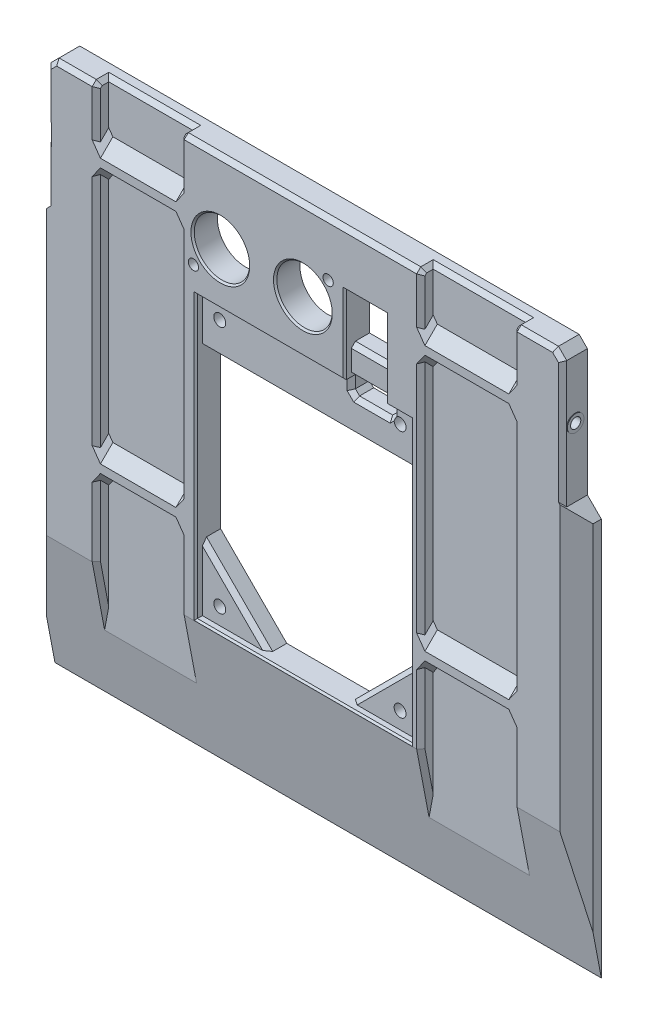
from build123d import *

# Parameters (mm, degrees)
SKETCH1_W               = 165.1
SKETCH1_H               = 165.1
BOSS_EXTRUDE1_DEPTH     = 7.5
SKETCH2_W               = 65
SKETCH2_H               = 85
SKETCH2_W_2             = 12.5
SKETCH2_H_2             = 8.722707295
CUT_EXTRUDE1_DEPTH      = 2
SKETCH3_R               = 1.8
CUT_EXTRUDE2_DEPTH      = 117.872815488
CUT_EXTRUDE5_DEPTH      = 117.872815488
CUT_EXTRUDE5_DEPTH_BACK = 117.872815488
SKETCH4_W               = 12.5
SKETCH4_H               = 15
SKETCH4_H_2             = 5
SKETCH5_R               = 1.55
SKETCH5_R_2             = 8.375
CUT_EXTRUDE6_DEPTH      = 117.983994632
CHAMFER1_SIZE           = 0.5
CHAMFER2_SIZE           = 1.25
CHAMFER3_SIZE           = 7.5
CHAMFER3_SIZE_2         = 39.5
SKETCH12_W              = 5
SKETCH12_H              = 40
SKETCH12_W_2            = 4.2
CUT_EXTRUDE11_DEPTH     = 117.983994632
SKETCH13_R              = 0.7
CUT_EXTRUDE12_DEPTH     = 10
SKETCH14_RX             = 11.205970324
SKETCH14_RY             = 3.425841458
CUT_EXTRUDE13_DEPTH     = 1.5
SKETCH15_R              = 1.55
CUT_EXTRUDE14_DEPTH     = 10
BOSS_EXTRUDE2_START     = 0.2
SKETCH16_R              = 2.5
SKETCH16_R_2            = 1.55
BOSS_EXTRUDE2_DEPTH     = 0.2
CHAMFER5_SIZE           = 5
CHAMFER6_SIZE           = 2.5
CHAMFER7_SIZE           = 1.25
CHAMFER8_SIZE           = 5
CHAMFER9_SIZE           = 1.25
CHAMFER10_SIZE          = 1.25
CHAMFER11_SIZE          = 1.25
SKETCH17_W              = 27.85
SKETCH17_H              = 3.75
SKETCH17_W_2            = 25.3
CUT_EXTRUDE15_DEPTH     = 185.739715684
SKETCH18_W              = 25.3
SKETCH18_H              = 10
SKETCH18_W_2            = 27.85
BOSS_EXTRUDE3_DEPTH     = 3.75
CHAMFER12_SIZE          = 3.75
CHAMFER14_SIZE          = 1.25
CHAMFER15_SIZE          = 1.25


# Some blends are built 0.0001 mm under size
with BuildPart() as part:
    # Sketch1 → Boss-Extrude1 (new body)
    with BuildSketch(Plane.XY):
        Rectangle(SKETCH1_W, SKETCH1_H)
    extrude(amount=BOSS_EXTRUDE1_DEPTH)

    # Sketch2 → Cut-Extrude1 (cut)
    with BuildSketch(Plane.XY.offset(7.5)):
        Rectangle(SKETCH2_W, SKETCH2_H)
        with Locations((18.75, 46.861353648)):
            Rectangle(SKETCH2_W_2, SKETCH2_H_2)
    extrude(amount=-CUT_EXTRUDE1_DEPTH, mode=Mode.SUBTRACT)

    # Sketch3 → Cut-Extrude2 (cut, through all)
    with BuildSketch(Plane.XY.offset(5.5)):
        with Locations((-27.25, 37.5)):
            Circle(SKETCH3_R)
        with Locations((27.25, 37.5)):
            Circle(SKETCH3_R)
        with Locations((-27.25, -37.5)):
            Circle(SKETCH3_R)
        with Locations((27.25, -37.5)):
            Circle(SKETCH3_R)
    extrude(amount=-CUT_EXTRUDE2_DEPTH, mode=Mode.SUBTRACT)

    # Sketch4 → Cut-Extrude5 (cut, two sides: drawn at the far end of the back side and taken through both)
    with BuildSketch(Plane.XY.offset(5.5).offset(-CUT_EXTRUDE5_DEPTH_BACK)):
        Polygon((-32.5, 27.5), (32.5, 27.5), (32.5, -22.5), (12.5, -42.5), (-12.5, -42.5), (-32.5, -22.5), align=None)
        with Locations((18.75, 58.722707295)):
            Rectangle(SKETCH4_W, SKETCH4_H)
        with Locations((18.75, 40)):
            Rectangle(SKETCH4_W, SKETCH4_H_2)
    extrude(amount=CUT_EXTRUDE5_DEPTH + CUT_EXTRUDE5_DEPTH_BACK, mode=Mode.SUBTRACT)

    # Sketch5 → Cut-Extrude6 (cut, through all)
    with BuildSketch(Plane(origin=(0, 0, 0), x_dir=(-1, 0, 0), z_dir=(0, 0, -1))):
        with Locations((-7.5, 66.3)):
            Circle(SKETCH5_R)
        with Locations((33.2, 50)):
            Circle(SKETCH5_R)
        with Locations((0.129678703, 58.15)):
            Circle(SKETCH5_R_2)
        with Locations(Location((25.079678703, 58.15, 0), (0, 0, 180))):
            Circle(SKETCH5_R_2)
    extrude(amount=-CUT_EXTRUDE6_DEPTH, mode=Mode.SUBTRACT)

    # Chamfer1
    chamfer1_edges = [part.edges().sort_by_distance(p)[0] for p in [
        (8.245321297, 58.15, 7.5),
        (-33.454678703, 58.15, 7.5),
        (32.5, 0, 7.5),
        (-10, 42.5, 7.5),
        (12.5, 54.361353648, 7.5),
        (28.75, 42.5, 7.5),
        (25, 54.361353648, 7.5),
        (-32.5, 0, 7.5),
        (0, -42.5, 7.5),
        (18.75, 66.222707295, 7.5),
    ]]
    chamfer(chamfer1_edges, length=CHAMFER1_SIZE)

    # Chamfer2
    chamfer2_edges = [part.edges().sort_by_distance(p)[0] for p in [
        (12.5, 37.5, 2.75),
        (25, 37.5, 2.75),
    ]]
    chamfer(chamfer2_edges, length=CHAMFER2_SIZE)

    # Chamfer3
    # the kernel refuses this chamfer: 39.5, 7.5 mm, written as the material it takes off along each edge
    with BuildSketch(Plane(origin=(-185.183311652, -82.55, 7.5), x_dir=(0, -0.1953078881118558, -0.9807419787290064), z_dir=(1, 0, 0))) as chamfer3_piece_1:
        Polygon((CHAMFER3_SIZE * 0.980741978729, CHAMFER3_SIZE * 0.195307888112), (-CHAMFER3_SIZE_2 * 0.195307888112, CHAMFER3_SIZE_2 * 0.980741978729), (0, 0), align=None)
    extrude(amount=370.366623303, mode=Mode.SUBTRACT)

    # Sketch12 → Cut-Extrude11 (cut, through all)
    with BuildSketch(Plane.XY.offset(7.5)):
        with Locations((-80.05, 62.55)):
            Rectangle(SKETCH12_W, SKETCH12_H)
        with Locations((80.45, 62.55)):
            Rectangle(SKETCH12_W_2, SKETCH12_H)
    extrude(amount=-CUT_EXTRUDE11_DEPTH, mode=Mode.SUBTRACT)

    # Sketch13 → Cut-Extrude12 (cut)
    with BuildSketch(Plane.ZY.offset(77.55)):
        with Locations(Location((3.75, 67.55, 0), (0, 0, 270))):
            Circle(SKETCH13_R)
        with Locations(Location((3.75, 70.55, 0), (0, 0, 270))):
            Circle(SKETCH13_R)
        with Locations(Location((3.75, 73.55, 0), (0, 0, 270))):
            Circle(SKETCH13_R)
        with Locations(Location((3.75, 76.55, 0), (0, 0, 270))):
            Circle(SKETCH13_R)
        with Locations(Location((3.75, 48.55, 0), (0, 0, 90))):
            Circle(SKETCH13_R)
        with Locations(Location((3.75, 51.55, 0), (0, 0, 90))):
            Circle(SKETCH13_R)
        with Locations(Location((3.75, 54.55, 0), (0, 0, 90))):
            Circle(SKETCH13_R)
        with Locations(Location((3.75, 57.55, 0), (0, 0, 90))):
            Circle(SKETCH13_R)
    extrude(amount=-CUT_EXTRUDE12_DEPTH, mode=Mode.SUBTRACT)

    # Sketch14 → Cut-Extrude13 (cut)
    with BuildSketch(Plane.ZY.offset(77.55)):
        with Locations(Location((3.75, 62.55), (0, 0, 180))):
            Ellipse(SKETCH14_RX, SKETCH14_RY)
    extrude(amount=-CUT_EXTRUDE13_DEPTH, mode=Mode.SUBTRACT)

    # Sketch15 → Cut-Extrude14 (cut)
    with BuildSketch(Plane(origin=(78.35, 0, 0), x_dir=(0, 0, -1), z_dir=(1, 0, 0))):
        with Locations((-3.75, 62.55)):
            Circle(SKETCH15_R)
    extrude(amount=-CUT_EXTRUDE14_DEPTH, mode=Mode.SUBTRACT)

    # Sketch16 → Boss-Extrude2 (add)
    with BuildSketch(Plane(origin=(78.35, 0, 0), x_dir=(0, 0, -1), z_dir=(1, 0, 0)).offset(BOSS_EXTRUDE2_START)):
        with Locations(Location((-3.75, 62.55, 0), (0, 0, 180))):
            Circle(SKETCH16_R)
        with Locations((-3.75, 62.55)):
            Circle(SKETCH16_R_2, mode=Mode.SUBTRACT)
    extrude(amount=-BOSS_EXTRUDE2_DEPTH)

    # Chamfer5
    # the kernel refuses this chamfer: 5 mm, written as the material it takes off along each edge
    with BuildSketch(Plane(origin=(82.55, 42.55, 20.35841494), x_dir=(0.02749587661059046, -0.9996219169112965, 0), z_dir=(0, 0, -1))) as chamfer5_piece_1_section:
        Polygon((CHAMFER5_SIZE * 0.999621916911, CHAMFER5_SIZE * 0.0274958766106), (-CHAMFER5_SIZE * 0.0274958766106, CHAMFER5_SIZE * 0.999621916911), (0, 0), align=None)
    chamfer5_piece_1 = extrude(amount=33.21682988, mode=Mode.PRIVATE)
    chamfer5_piece_1 = split(chamfer5_piece_1, bisect_by=Plane(origin=(78.35, 40.843319127, 3.75), z_dir=(1, 0, 0)), keep=Keep.TOP, mode=Mode.PRIVATE)
    add(chamfer5_piece_1, mode=Mode.SUBTRACT)
    with BuildSketch(Plane(origin=(-82.55, 42.55, 20.35841494), x_dir=(0.9996219169112968, 0.027495876610586282, 0), z_dir=(0, 0, -1))) as chamfer5_piece_2_section:
        Polygon((CHAMFER5_SIZE * 0.999621916911, CHAMFER5_SIZE * 0.0274958766106), (-CHAMFER5_SIZE * 0.0274958766106, CHAMFER5_SIZE * 0.999621916911), (0, 0), align=None)
    chamfer5_piece_2 = extrude(amount=33.21682988, mode=Mode.PRIVATE)
    chamfer5_piece_2 = split(chamfer5_piece_2, bisect_by=Plane(origin=(-77.55, 40.897979228, 3.75), z_dir=(-1, 0, 0)), keep=Keep.TOP, mode=Mode.PRIVATE)
    add(chamfer5_piece_2, mode=Mode.SUBTRACT)

    # Chamfer6
    chamfer6_edges = [part.edges().sort_by_distance(p)[0] for p in [
        (-77.55, 82.55, 3.75),
        (78.35, 82.55, 3.75),
    ]]
    chamfer(chamfer6_edges, length=CHAMFER6_SIZE)

    # Chamfer7
    chamfer7_edges = [part.edges().sort_by_distance(p)[0] for p in [
        (-77.55, 50.935837774, 7.5),
        (-77.55, 72.914162226, 7.5),
        (78.35, 60.9, 7.5),
        (0.4, 82.55, 7.5),
        (-76.3, 81.3, 7.5),
        (77.1, 81.3, 7.5),
    ]]
    chamfer(chamfer7_edges, length=CHAMFER7_SIZE - 0.0001)  # a hair under: the kernel refuses the full size

    # Chamfer8
    chamfer8_edges = [part.edges().sort_by_distance(p)[0] for p in [
        (82.55, -2.75, 7.5),
        (-82.55, -2.75, 7.5),
    ]]
    chamfer(chamfer8_edges, length=CHAMFER8_SIZE)

    # Chamfer9
    # the kernel refuses this chamfer: 1.25 mm, written as the material it takes off along each edge
    with BuildSketch(Plane(origin=(26.964603735, 37.5, 5.5), x_dir=(0, 0.0274958766105877, -0.9996219169112968), z_dir=(-1, 0, 0))) as chamfer9_piece_1_section:
        Polygon((CHAMFER9_SIZE * 0.999621916911, CHAMFER9_SIZE * 0.0274958766106), (-CHAMFER9_SIZE * 0.0274958766106, CHAMFER9_SIZE * 0.999621916911), (0, 0), align=None)
    chamfer9_piece_1 = extrude(amount=16.42920747, mode=Mode.PRIVATE)
    chamfer9_piece_1 = split(chamfer9_piece_1, bisect_by=Plane(origin=(21.054692841, 34.804692841, 5.076195697), z_dir=(-0.7071067811865476, 0.7071067811865476, 0)), keep=Keep.TOP, mode=Mode.PRIVATE)
    chamfer9_piece_1 = split(chamfer9_piece_1, bisect_by=Plane(origin=(16.445307159, 34.804692841, 5.076195697), z_dir=(0.7071067811865476, 0.7071067811865476, 0)), keep=Keep.TOP, mode=Mode.PRIVATE)
    add(chamfer9_piece_1, mode=Mode.SUBTRACT)
    with BuildSketch(Plane(origin=(25, 42.5, 5.5), x_dir=(-0.0274958766105877, 0, -0.9996219169112968), z_dir=(0, -1, 0))) as chamfer9_piece_2_section:
        Polygon((CHAMFER9_SIZE * 0.999621916911, CHAMFER9_SIZE * 0.0274958766106), (-CHAMFER9_SIZE * 0.0274958766106, CHAMFER9_SIZE * 0.999621916911), (0, 0), align=None)
    chamfer9_piece_2 = extrude(amount=6.964603735, mode=Mode.PRIVATE)
    chamfer9_piece_2 = split(chamfer9_piece_2, bisect_by=Plane(origin=(26.224386007, 39.974386007, 5.071865593), z_dir=(-0.7071067811865476, 0.7071067811865476, 0)), keep=Keep.TOP, mode=Mode.PRIVATE)
    add(chamfer9_piece_2, mode=Mode.SUBTRACT)
    with BuildSketch(Plane(origin=(10.2269319, 41.0230681, 5.5), x_dir=(0.019442520806013795, 0.019442520806013795, -0.9996219169112968), z_dir=(0.7071067811865476, -0.7071067811865476, 0))) as chamfer9_piece_3_section:
        Polygon((CHAMFER9_SIZE * 0.999621916911, -CHAMFER9_SIZE * 0.0274958766106), (-CHAMFER9_SIZE * 0.0274958766106, -CHAMFER9_SIZE * 0.999621916911), (0, 0), align=None)
    chamfer9_piece_3 = extrude(amount=8.196974423, mode=Mode.PRIVATE)
    chamfer9_piece_3 = split(chamfer9_piece_3, bisect_by=Plane(origin=(12.350335943, 37.5, 5.446070934), z_dir=(0, -1, 0)), keep=Keep.TOP, mode=Mode.PRIVATE)
    chamfer9_piece_3 = split(chamfer9_piece_3, bisect_by=Plane(origin=(12.5, 37.350335943, 5.446070934), z_dir=(-1, 0, 0)), keep=Keep.TOP, mode=Mode.PRIVATE)
    add(chamfer9_piece_3, mode=Mode.SUBTRACT)
    with BuildSketch(Plane(origin=(10.2269319, 41.0230681, 5.5), x_dir=(0.019442520806013795, 0.019442520806013795, -0.9996219169112968), z_dir=(0.7071067811865476, -0.7071067811865476, 0))) as chamfer9_piece_4_section:
        Polygon((CHAMFER9_SIZE * 0.999621916911, -CHAMFER9_SIZE * 0.0274958766106), (-CHAMFER9_SIZE * 0.0274958766106, -CHAMFER9_SIZE * 0.999621916911), (0, 0), align=None)
    chamfer9_piece_4 = extrude(amount=8.196974423, mode=Mode.PRIVATE)
    chamfer9_piece_4 = split(chamfer9_piece_4, bisect_by=Plane(origin=(12.964093962, 37.5, 4.988823058), z_dir=(0, 1, 0)), keep=Keep.TOP, mode=Mode.PRIVATE)
    chamfer9_piece_4 = split(chamfer9_piece_4, bisect_by=Plane(origin=(12.5, 37.964093962, 4.988823058), z_dir=(1, 0, 0)), keep=Keep.TOP, mode=Mode.PRIVATE)
    add(chamfer9_piece_4, mode=Mode.SUBTRACT)
    with BuildSketch(Plane(origin=(27.2730681, 41.0230681, 5.5), x_dir=(-0.0194425208060131, 0.0194425208060131, -0.9996219169112968), z_dir=(-0.7071067811865476, -0.7071067811865476, 0))) as chamfer9_piece_5_section:
        Polygon((CHAMFER9_SIZE * 0.999621916911, CHAMFER9_SIZE * 0.0274958766106), (-CHAMFER9_SIZE * 0.0274958766106, CHAMFER9_SIZE * 0.999621916911), (0, 0), align=None)
    chamfer9_piece_5 = extrude(amount=8.196974423, mode=Mode.PRIVATE)
    chamfer9_piece_5 = split(chamfer9_piece_5, bisect_by=Plane(origin=(25, 37.350335943, 5.446070934), z_dir=(1, 0, 0)), keep=Keep.TOP, mode=Mode.PRIVATE)
    chamfer9_piece_5 = split(chamfer9_piece_5, bisect_by=Plane(origin=(25.149664057, 37.5, 5.446070934), z_dir=(0, -1, 0)), keep=Keep.TOP, mode=Mode.PRIVATE)
    add(chamfer9_piece_5, mode=Mode.SUBTRACT)
    with BuildSketch(Plane(origin=(27.2730681, 41.0230681, 5.5), x_dir=(-0.0194425208060131, 0.0194425208060131, -0.9996219169112968), z_dir=(-0.7071067811865476, -0.7071067811865476, 0))) as chamfer9_piece_6_section:
        Polygon((CHAMFER9_SIZE * 0.999621916911, CHAMFER9_SIZE * 0.0274958766106), (-CHAMFER9_SIZE * 0.0274958766106, CHAMFER9_SIZE * 0.999621916911), (0, 0), align=None)
    chamfer9_piece_6 = extrude(amount=8.196974423, mode=Mode.PRIVATE)
    chamfer9_piece_6 = split(chamfer9_piece_6, bisect_by=Plane(origin=(25, 37.964093962, 4.988823058), z_dir=(-1, 0, 0)), keep=Keep.TOP, mode=Mode.PRIVATE)
    chamfer9_piece_6 = split(chamfer9_piece_6, bisect_by=Plane(origin=(24.535906038, 37.5, 4.988823058), z_dir=(0, 1, 0)), keep=Keep.TOP, mode=Mode.PRIVATE)
    add(chamfer9_piece_6, mode=Mode.SUBTRACT)
    with BuildSketch(Plane(origin=(12.5, 35.535396265, 5.5), x_dir=(0.027495876610586317, 0, -0.9996219169112968), z_dir=(0, 1, 0))) as chamfer9_piece_7_section:
        Polygon((CHAMFER9_SIZE * 0.999621916911, CHAMFER9_SIZE * 0.0274958766106), (-CHAMFER9_SIZE * 0.0274958766106, CHAMFER9_SIZE * 0.999621916911), (0, 0), align=None)
    chamfer9_piece_7 = extrude(amount=6.964603735, mode=Mode.PRIVATE)
    chamfer9_piece_7 = split(chamfer9_piece_7, bisect_by=Plane(origin=(11.275613993, 39.974386007, 5.071865593), z_dir=(0.7071067811865476, 0.7071067811865476, 0)), keep=Keep.TOP, mode=Mode.PRIVATE)
    add(chamfer9_piece_7, mode=Mode.SUBTRACT)
    with BuildSketch(Plane(origin=(27.2730681, 41.0230681, 5.5), x_dir=(-0.0194425208060131, 0.0194425208060131, -0.9996219169112968), z_dir=(-0.7071067811865476, -0.7071067811865476, 0))) as chamfer9_piece_8a_section:
        Polygon((CHAMFER9_SIZE * 0.999621916911, CHAMFER9_SIZE * 0.0274958766106), (-CHAMFER9_SIZE * 0.0274958766106, CHAMFER9_SIZE * 0.999621916911), (0, 0), align=None)
    chamfer9_piece_8a = extrude(amount=8.196974423, mode=Mode.PRIVATE)
    chamfer9_piece_8a = split(chamfer9_piece_8a, bisect_by=Plane(origin=(25, 36.199182289, 5.099717349), z_dir=(-1, 0, 0)), keep=Keep.TOP, mode=Mode.PRIVATE)
    chamfer9_piece_8a = split(chamfer9_piece_8a, bisect_by=Plane(origin=(23.063674005, 37.5, 5.099717349), z_dir=(0, -1, 0)), keep=Keep.TOP, mode=Mode.PRIVATE)
    with BuildSketch(Plane(origin=(26.964603735, 37.5, 5.5), x_dir=(0, 0.0274958766105877, -0.9996219169112968), z_dir=(-1, 0, 0))) as chamfer9_piece_8b_section:
        Polygon((CHAMFER9_SIZE * 0.999621916911, CHAMFER9_SIZE * 0.0274958766106), (-CHAMFER9_SIZE * 0.0274958766106, CHAMFER9_SIZE * 0.999621916911), (0, 0), align=None)
    chamfer9_piece_8b = extrude(amount=16.42920747, mode=Mode.PRIVATE)
    chamfer9_piece_8b = split(chamfer9_piece_8b, bisect_by=Plane(origin=(24.223951017, 37.973951017, 5.102383594), z_dir=(0.7071067811865476, -0.7071067811865476, 0)), keep=Keep.TOP, mode=Mode.PRIVATE)
    chamfer9_piece_8 = chamfer9_piece_8a & chamfer9_piece_8b
    add(chamfer9_piece_8, mode=Mode.SUBTRACT)
    with BuildSketch(Plane(origin=(26.964603735, 37.5, 5.5), x_dir=(0, 0.0274958766105877, -0.9996219169112968), z_dir=(-1, 0, 0))) as chamfer9_piece_9a_section:
        Polygon((CHAMFER9_SIZE * 0.999621916911, CHAMFER9_SIZE * 0.0274958766106), (-CHAMFER9_SIZE * 0.0274958766106, CHAMFER9_SIZE * 0.999621916911), (0, 0), align=None)
    chamfer9_piece_9a = extrude(amount=16.42920747, mode=Mode.PRIVATE)
    chamfer9_piece_9a = split(chamfer9_piece_9a, bisect_by=Plane(origin=(13.276048983, 37.973951017, 5.102383594), z_dir=(-0.7071067811865476, -0.7071067811865476, 0)), keep=Keep.TOP, mode=Mode.PRIVATE)
    with BuildSketch(Plane(origin=(10.2269319, 41.0230681, 5.5), x_dir=(0.019442520806013795, 0.019442520806013795, -0.9996219169112968), z_dir=(0.7071067811865476, -0.7071067811865476, 0))) as chamfer9_piece_9b_section:
        Polygon((CHAMFER9_SIZE * 0.999621916911, -CHAMFER9_SIZE * 0.0274958766106), (-CHAMFER9_SIZE * 0.0274958766106, -CHAMFER9_SIZE * 0.999621916911), (0, 0), align=None)
    chamfer9_piece_9b = extrude(amount=8.196974423, mode=Mode.PRIVATE)
    chamfer9_piece_9b = split(chamfer9_piece_9b, bisect_by=Plane(origin=(14.436325995, 37.5, 5.099717349), z_dir=(0, -1, 0)), keep=Keep.TOP, mode=Mode.PRIVATE)
    chamfer9_piece_9b = split(chamfer9_piece_9b, bisect_by=Plane(origin=(12.5, 36.199182289, 5.099717349), z_dir=(1, 0, 0)), keep=Keep.TOP, mode=Mode.PRIVATE)
    chamfer9_piece_9 = chamfer9_piece_9a & chamfer9_piece_9b
    add(chamfer9_piece_9, mode=Mode.SUBTRACT)
    with BuildSketch(Plane(origin=(25, 42.5, 5.5), x_dir=(-0.0274958766105877, 0, -0.9996219169112968), z_dir=(0, -1, 0))) as chamfer9_piece_10a_section:
        Polygon((CHAMFER9_SIZE * 0.999621916911, CHAMFER9_SIZE * 0.0274958766106), (-CHAMFER9_SIZE * 0.0274958766106, CHAMFER9_SIZE * 0.999621916911), (0, 0), align=None)
    chamfer9_piece_10a = extrude(amount=6.964603735, mode=Mode.PRIVATE)
    chamfer9_piece_10a = split(chamfer9_piece_10a, bisect_by=Plane(origin=(24.526048983, 38.276048983, 5.102383594), z_dir=(0.7071067811865476, -0.7071067811865476, 0)), keep=Keep.TOP, mode=Mode.PRIVATE)
    with BuildSketch(Plane(origin=(27.2730681, 41.0230681, 5.5), x_dir=(-0.0194425208060131, 0.0194425208060131, -0.9996219169112968), z_dir=(-0.7071067811865476, -0.7071067811865476, 0))) as chamfer9_piece_10b_section:
        Polygon((CHAMFER9_SIZE * 0.999621916911, CHAMFER9_SIZE * 0.0274958766106), (-CHAMFER9_SIZE * 0.0274958766106, CHAMFER9_SIZE * 0.999621916911), (0, 0), align=None)
    chamfer9_piece_10b = extrude(amount=8.196974423, mode=Mode.PRIVATE)
    chamfer9_piece_10b = split(chamfer9_piece_10b, bisect_by=Plane(origin=(25, 39.436325995, 5.099717349), z_dir=(1, 0, 0)), keep=Keep.TOP, mode=Mode.PRIVATE)
    chamfer9_piece_10b = split(chamfer9_piece_10b, bisect_by=Plane(origin=(26.300817711, 37.5, 5.099717349), z_dir=(0, 1, 0)), keep=Keep.TOP, mode=Mode.PRIVATE)
    chamfer9_piece_10 = chamfer9_piece_10a & chamfer9_piece_10b
    add(chamfer9_piece_10, mode=Mode.SUBTRACT)
    with BuildSketch(Plane(origin=(12.5, 35.535396265, 5.5), x_dir=(0.027495876610586317, 0, -0.9996219169112968), z_dir=(0, 1, 0))) as chamfer9_piece_11a_section:
        Polygon((CHAMFER9_SIZE * 0.999621916911, CHAMFER9_SIZE * 0.0274958766106), (-CHAMFER9_SIZE * 0.0274958766106, CHAMFER9_SIZE * 0.999621916911), (0, 0), align=None)
    chamfer9_piece_11a = extrude(amount=6.964603735, mode=Mode.PRIVATE)
    chamfer9_piece_11a = split(chamfer9_piece_11a, bisect_by=Plane(origin=(12.973951017, 38.276048983, 5.102383594), z_dir=(-0.7071067811865476, -0.7071067811865476, 0)), keep=Keep.TOP, mode=Mode.PRIVATE)
    with BuildSketch(Plane(origin=(10.2269319, 41.0230681, 5.5), x_dir=(0.019442520806013795, 0.019442520806013795, -0.9996219169112968), z_dir=(0.7071067811865476, -0.7071067811865476, 0))) as chamfer9_piece_11b_section:
        Polygon((CHAMFER9_SIZE * 0.999621916911, -CHAMFER9_SIZE * 0.0274958766106), (-CHAMFER9_SIZE * 0.0274958766106, -CHAMFER9_SIZE * 0.999621916911), (0, 0), align=None)
    chamfer9_piece_11b = extrude(amount=8.196974423, mode=Mode.PRIVATE)
    chamfer9_piece_11b = split(chamfer9_piece_11b, bisect_by=Plane(origin=(11.199182289, 37.5, 5.099717349), z_dir=(0, 1, 0)), keep=Keep.TOP, mode=Mode.PRIVATE)
    chamfer9_piece_11b = split(chamfer9_piece_11b, bisect_by=Plane(origin=(12.5, 39.436325995, 5.099717349), z_dir=(-1, 0, 0)), keep=Keep.TOP, mode=Mode.PRIVATE)
    chamfer9_piece_11 = chamfer9_piece_11a & chamfer9_piece_11b
    add(chamfer9_piece_11, mode=Mode.SUBTRACT)

    # Chamfer10
    chamfer10_edges = [part.edges().sort_by_distance(p)[0] for p in [
        (18.75, 51.222707295, 5.5),
        (18.75, 42.5, 5.5),
    ]]
    chamfer(chamfer10_edges, length=CHAMFER10_SIZE - 0.0001)  # a hair under: the kernel refuses the full size

    # Chamfer11
    chamfer11_edges = [part.edges().sort_by_distance(p)[0] for p in [
        (-22.5, -32.5, 5.5),
        (22.5, -32.5, 5.5),
        (0, 27.5, 5.5),
    ]]
    chamfer(chamfer11_edges, length=CHAMFER11_SIZE)

    # Sketch17 → Cut-Extrude15 (cut, through all)
    with BuildSketch(Plane(origin=(0, 82.55, 0), x_dir=(1, 0, 0), z_dir=(0, 1, 0))):
        with Locations((49.425, -5.625)):
            Rectangle(SKETCH17_W, SKETCH17_H)
        with Locations((-49.9, -5.625)):
            Rectangle(SKETCH17_W_2, SKETCH17_H)
    extrude(amount=-CUT_EXTRUDE15_DEPTH, mode=Mode.SUBTRACT)

    # Sketch18 → Boss-Extrude3 (add)
    with BuildSketch(Plane.XY.offset(3.75)):
        with Locations((-49.9, 62.55)):
            Rectangle(SKETCH18_W, SKETCH18_H)
        with Locations((49.425, 62.55)):
            Rectangle(SKETCH18_W_2, SKETCH18_H)
        with Locations((49.425, -17.45)):
            Rectangle(SKETCH18_W_2, SKETCH18_H)
        with Locations((-49.9, -17.45)):
            Rectangle(SKETCH18_W, SKETCH18_H)
    extrude(amount=BOSS_EXTRUDE3_DEPTH)

    # Chamfer12
    chamfer12_edges = [part.edges().sort_by_distance(p)[0] for p in [
        (-49.9, -12.45, 7.5),
        (-49.9, -22.45, 7.5),
        (49.425, -22.45, 7.5),
        (49.425, -12.45, 7.5),
        (49.425, 57.55, 7.5),
        (49.425, 67.55, 7.5),
        (-49.9, 67.55, 7.5),
        (-49.9, 57.55, 7.5),
    ]]
    chamfer(chamfer12_edges, length=CHAMFER12_SIZE - 0.0001)  # a hair under: the kernel refuses the full size

    # Chamfer13
    # the kernel refuses this chamfer: 1.25 mm, written as the material it adds along each edge
    with BuildSketch(Plane(origin=(-62.55, -18.4729681, 9.7730681), x_dir=(-0.02749587661058782, 0.7068394360706736, 0.7068394360706732), z_dir=(2.560750109497795e-15, 0.7071067811865475, -0.7071067811865477))) as chamfer13_piece_1_section:
        with BuildLine():
            Line((1.285841494, 0), (-0.070683944, 1.283897242))
            Line((-0.070683944, 1.283897242), (-0.095674492, 1.283209845))
            ThreePointArc((-0.095674492, 1.283209845), (-0.042661534, 0.641747287), (-0.024990548, -0.000687397))
            Line((-0.024990548, -0.000687397), (0.000687397, -0.024990548))
            ThreePointArc((0.000687397, -0.024990548), (0.643122081, -0.007319562), (1.286528891, -0.024990548))
            Line((1.286528891, -0.024990548), (1.285841494, 0))
        make_face()
    chamfer13_piece_1 = extrude(amount=11.732366907, mode=Mode.PRIVATE)
    chamfer13_piece_1 = split(chamfer13_piece_1, bisect_by=Plane(origin=(-62.114070206, -14.064782029, 7.5), z_dir=(0, 0, -1)), keep=Keep.TOP, mode=Mode.PRIVATE)
    add(chamfer13_piece_1)
    with BuildSketch(Plane(origin=(-37.25, -18.4729681, 9.7730681), x_dir=(0.027495876610587604, 0.7068394360706736, 0.7068394360706733), z_dir=(0, 0.7071067811865475, -0.7071067811865477))) as chamfer13_piece_2_section:
        with BuildLine():
            Line((1.285841494, 0), (-0.070683944, -1.283897242))
            Line((-0.070683944, -1.283897242), (-0.095674492, -1.283209845))
            ThreePointArc((-0.095674492, -1.283209845), (-0.042661534, -0.641747287), (-0.024990548, 0.000687397))
            Line((-0.024990548, 0.000687397), (0.000687397, 0.024990548))
            ThreePointArc((0.000687397, 0.024990548), (0.643122081, 0.007319562), (1.286528891, 0.024990548))
            Line((1.286528891, 0.024990548), (1.285841494, 0))
        make_face()
    chamfer13_piece_2 = extrude(amount=11.732366907, mode=Mode.PRIVATE)
    chamfer13_piece_2 = split(chamfer13_piece_2, bisect_by=Plane(origin=(-37.685929794, -14.064782029, 7.5), z_dir=(0, 0, -1)), keep=Keep.TOP, mode=Mode.PRIVATE)
    add(chamfer13_piece_2)
    with BuildSketch(Plane(origin=(-62.55, -16.4270319, 9.7730681), x_dir=(0.9996219169112968, 0.019442520806014364, -0.01944252080601041), z_dir=(2.798498816142824e-15, -0.7071067811865476, -0.7071067811865475))) as chamfer13_piece_3_section:
        with BuildLine():
            Line((1.285841494, 0), (-0.070683944, 1.283897242))
            Line((-0.070683944, 1.283897242), (-0.095674492, 1.283209845))
            ThreePointArc((-0.095674492, 1.283209845), (-0.042661534, 0.641747287), (-0.024990548, -0.000687397))
            Line((-0.024990548, -0.000687397), (0.000687397, -0.024990548))
            ThreePointArc((0.000687397, -0.024990548), (0.643122081, -0.007319562), (1.286528891, -0.024990548))
            Line((1.286528891, -0.024990548), (1.285841494, 0))
        make_face()
    chamfer13_piece_3 = extrude(amount=11.732366907, mode=Mode.PRIVATE)
    chamfer13_piece_3 = split(chamfer13_piece_3, bisect_by=Plane(origin=(-62.114070206, -20.835217971, 7.5), z_dir=(0, 0, -1)), keep=Keep.TOP, mode=Mode.PRIVATE)
    add(chamfer13_piece_3)
    with BuildSketch(Plane(origin=(-37.25, -16.4270319, 9.7730681), x_dir=(0.02749587661058782, -0.7068394360706733, 0.7068394360706735), z_dir=(0, -0.7071067811865476, -0.7071067811865475))) as chamfer13_piece_4_section:
        with BuildLine():
            Line((1.285841494, 0), (-0.070683944, 1.283897242))
            Line((-0.070683944, 1.283897242), (-0.095674492, 1.283209845))
            ThreePointArc((-0.095674492, 1.283209845), (-0.042661534, 0.641747287), (-0.024990548, -0.000687397))
            Line((-0.024990548, -0.000687397), (0.000687397, -0.024990548))
            ThreePointArc((0.000687397, -0.024990548), (0.643122081, -0.007319562), (1.286528891, -0.024990548))
            Line((1.286528891, -0.024990548), (1.285841494, 0))
        make_face()
    chamfer13_piece_4 = extrude(amount=11.732366907, mode=Mode.PRIVATE)
    chamfer13_piece_4 = split(chamfer13_piece_4, bisect_by=Plane(origin=(-37.685929794, -20.835217971, 7.5), z_dir=(0, 0, -1)), keep=Keep.TOP, mode=Mode.PRIVATE)
    add(chamfer13_piece_4)
    with BuildSketch(Plane(origin=(63.35, -16.4270319, 9.7730681), x_dir=(0.02749587661058782, -0.7068394360706733, 0.7068394360706735), z_dir=(0, -0.7071067811865476, -0.7071067811865475))) as chamfer13_piece_5_section:
        with BuildLine():
            Line((1.285841494, 0), (-0.070683944, 1.283897242))
            Line((-0.070683944, 1.283897242), (-0.095674492, 1.283209845))
            ThreePointArc((-0.095674492, 1.283209845), (-0.042661534, 0.641747287), (-0.024990548, -0.000687397))
            Line((-0.024990548, -0.000687397), (0.000687397, -0.024990548))
            ThreePointArc((0.000687397, -0.024990548), (0.643122081, -0.007319562), (1.286528891, -0.024990548))
            Line((1.286528891, -0.024990548), (1.285841494, 0))
        make_face()
    chamfer13_piece_5 = extrude(amount=11.732366907, mode=Mode.PRIVATE)
    chamfer13_piece_5 = split(chamfer13_piece_5, bisect_by=Plane(origin=(62.914070206, -20.835217971, 7.5), z_dir=(0, 0, -1)), keep=Keep.TOP, mode=Mode.PRIVATE)
    add(chamfer13_piece_5)
    with BuildSketch(Plane(origin=(35.5, -16.4270319, 9.7730681), x_dir=(0.9996219169112968, 0.019442520806013847, -0.019442520806013684), z_dir=(0, -0.7071067811865476, -0.7071067811865475))) as chamfer13_piece_6_section:
        with BuildLine():
            Line((1.285841494, 0), (-0.070683944, 1.283897242))
            Line((-0.070683944, 1.283897242), (-0.095674492, 1.283209845))
            ThreePointArc((-0.095674492, 1.283209845), (-0.042661534, 0.641747287), (-0.024990548, -0.000687397))
            Line((-0.024990548, -0.000687397), (0.000687397, -0.024990548))
            ThreePointArc((0.000687397, -0.024990548), (0.643122081, -0.007319562), (1.286528891, -0.024990548))
            Line((1.286528891, -0.024990548), (1.285841494, 0))
        make_face()
    chamfer13_piece_6 = extrude(amount=11.732366907, mode=Mode.PRIVATE)
    chamfer13_piece_6 = split(chamfer13_piece_6, bisect_by=Plane(origin=(35.935929794, -20.835217971, 7.5), z_dir=(0, 0, -1)), keep=Keep.TOP, mode=Mode.PRIVATE)
    add(chamfer13_piece_6)
    with BuildSketch(Plane(origin=(35.5, -18.4729681, 9.7730681), x_dir=(-0.02749587661058782, 0.7068394360706735, 0.7068394360706733), z_dir=(0, 0.7071067811865475, -0.7071067811865477))) as chamfer13_piece_7_section:
        with BuildLine():
            Line((1.285841494, 0), (-0.070683944, 1.283897242))
            Line((-0.070683944, 1.283897242), (-0.095674492, 1.283209845))
            ThreePointArc((-0.095674492, 1.283209845), (-0.042661534, 0.641747287), (-0.024990548, -0.000687397))
            Line((-0.024990548, -0.000687397), (0.000687397, -0.024990548))
            ThreePointArc((0.000687397, -0.024990548), (0.643122081, -0.007319562), (1.286528891, -0.024990548))
            Line((1.286528891, -0.024990548), (1.285841494, 0))
        make_face()
    chamfer13_piece_7 = extrude(amount=11.732366907, mode=Mode.PRIVATE)
    chamfer13_piece_7 = split(chamfer13_piece_7, bisect_by=Plane(origin=(35.935929794, -14.064782029, 7.5), z_dir=(0, 0, -1)), keep=Keep.TOP, mode=Mode.PRIVATE)
    add(chamfer13_piece_7)
    with BuildSketch(Plane(origin=(63.35, -18.4729681, 9.7730681), x_dir=(0.027495876610587604, 0.7068394360706736, 0.7068394360706733), z_dir=(0, 0.7071067811865475, -0.7071067811865477))) as chamfer13_piece_8_section:
        with BuildLine():
            Line((1.285841494, 0), (-0.070683944, -1.283897242))
            Line((-0.070683944, -1.283897242), (-0.095674492, -1.283209845))
            ThreePointArc((-0.095674492, -1.283209845), (-0.042661534, -0.641747287), (-0.024990548, 0.000687397))
            Line((-0.024990548, 0.000687397), (0.000687397, 0.024990548))
            ThreePointArc((0.000687397, 0.024990548), (0.643122081, 0.007319562), (1.286528891, 0.024990548))
            Line((1.286528891, 0.024990548), (1.285841494, 0))
        make_face()
    chamfer13_piece_8 = extrude(amount=11.732366907, mode=Mode.PRIVATE)
    chamfer13_piece_8 = split(chamfer13_piece_8, bisect_by=Plane(origin=(62.914070206, -14.064782029, 7.5), z_dir=(0, 0, -1)), keep=Keep.TOP, mode=Mode.PRIVATE)
    add(chamfer13_piece_8)
    with BuildSketch(Plane(origin=(35.5, 63.5729681, 9.7730681), x_dir=(0.9996219169112968, 0.019442520806013858, -0.019442520806013674), z_dir=(0, -0.7071067811865472, -0.7071067811865478))) as chamfer13_piece_9_section:
        with BuildLine():
            Line((1.285841494, 0), (-0.070683944, 1.283897242))
            Line((-0.070683944, 1.283897242), (-0.095674492, 1.283209845))
            ThreePointArc((-0.095674492, 1.283209845), (-0.042661534, 0.641747287), (-0.024990548, -0.000687397))
            Line((-0.024990548, -0.000687397), (0.000687397, -0.024990548))
            ThreePointArc((0.000687397, -0.024990548), (0.643122081, -0.007319562), (1.286528891, -0.024990548))
            Line((1.286528891, -0.024990548), (1.285841494, 0))
        make_face()
    chamfer13_piece_9 = extrude(amount=11.732366907, mode=Mode.PRIVATE)
    chamfer13_piece_9 = split(chamfer13_piece_9, bisect_by=Plane(origin=(35.935929794, 59.164782029, 7.5), z_dir=(0, 0, -1)), keep=Keep.TOP, mode=Mode.PRIVATE)
    add(chamfer13_piece_9)
    with BuildSketch(Plane(origin=(63.35, 63.5729681, 9.7730681), x_dir=(0.02749587661058782, -0.7068394360706737, 0.7068394360706731), z_dir=(0, -0.7071067811865472, -0.7071067811865478))) as chamfer13_piece_10_section:
        with BuildLine():
            Line((1.285841494, 0), (-0.070683944, 1.283897242))
            Line((-0.070683944, 1.283897242), (-0.095674492, 1.283209845))
            ThreePointArc((-0.095674492, 1.283209845), (-0.042661534, 0.641747287), (-0.024990548, -0.000687397))
            Line((-0.024990548, -0.000687397), (0.000687397, -0.024990548))
            ThreePointArc((0.000687397, -0.024990548), (0.643122081, -0.007319562), (1.286528891, -0.024990548))
            Line((1.286528891, -0.024990548), (1.285841494, 0))
        make_face()
    chamfer13_piece_10 = extrude(amount=11.732366907, mode=Mode.PRIVATE)
    chamfer13_piece_10 = split(chamfer13_piece_10, bisect_by=Plane(origin=(62.914070206, 59.164782029, 7.5), z_dir=(0, 0, -1)), keep=Keep.TOP, mode=Mode.PRIVATE)
    add(chamfer13_piece_10)
    with BuildSketch(Plane(origin=(63.35, 61.5270319, 9.7730681), x_dir=(-0.9996219169112968, -0.019442520806013858, -0.019442520806013674), z_dir=(0, 0.7071067811865474, -0.7071067811865478))) as chamfer13_piece_11_section:
        with BuildLine():
            Line((1.285841494, 0), (-0.070683944, 1.283897242))
            Line((-0.070683944, 1.283897242), (-0.095674492, 1.283209845))
            ThreePointArc((-0.095674492, 1.283209845), (-0.042661534, 0.641747287), (-0.024990548, -0.000687397))
            Line((-0.024990548, -0.000687397), (0.000687397, -0.024990548))
            ThreePointArc((0.000687397, -0.024990548), (0.643122081, -0.007319562), (1.286528891, -0.024990548))
            Line((1.286528891, -0.024990548), (1.285841494, 0))
        make_face()
    chamfer13_piece_11 = extrude(amount=11.732366907, mode=Mode.PRIVATE)
    chamfer13_piece_11 = split(chamfer13_piece_11, bisect_by=Plane(origin=(62.914070206, 65.935217971, 7.5), z_dir=(0, 0, -1)), keep=Keep.TOP, mode=Mode.PRIVATE)
    add(chamfer13_piece_11)
    with BuildSketch(Plane(origin=(35.5, 61.5270319, 9.7730681), x_dir=(-0.02749587661058782, 0.7068394360706736, 0.7068394360706732), z_dir=(0, 0.7071067811865474, -0.7071067811865478))) as chamfer13_piece_12_section:
        with BuildLine():
            Line((1.285841494, 0), (-0.070683944, 1.283897242))
            Line((-0.070683944, 1.283897242), (-0.095674492, 1.283209845))
            ThreePointArc((-0.095674492, 1.283209845), (-0.042661534, 0.641747287), (-0.024990548, -0.000687397))
            Line((-0.024990548, -0.000687397), (0.000687397, -0.024990548))
            ThreePointArc((0.000687397, -0.024990548), (0.643122081, -0.007319562), (1.286528891, -0.024990548))
            Line((1.286528891, -0.024990548), (1.285841494, 0))
        make_face()
    chamfer13_piece_12 = extrude(amount=11.732366907, mode=Mode.PRIVATE)
    chamfer13_piece_12 = split(chamfer13_piece_12, bisect_by=Plane(origin=(35.935929794, 65.935217971, 7.5), z_dir=(0, 0, -1)), keep=Keep.TOP, mode=Mode.PRIVATE)
    add(chamfer13_piece_12)
    with BuildSketch(Plane(origin=(-62.55, 61.5270319, 9.7730681), x_dir=(-0.02749587661058782, 0.7068394360706738, 0.7068394360706731), z_dir=(2.5607501094977958e-15, 0.7071067811865472, -0.7071067811865478))) as chamfer13_piece_13_section:
        with BuildLine():
            Line((1.285841494, 0), (-0.070683944, 1.283897242))
            Line((-0.070683944, 1.283897242), (-0.095674492, 1.283209845))
            ThreePointArc((-0.095674492, 1.283209845), (-0.042661534, 0.641747287), (-0.024990548, -0.000687397))
            Line((-0.024990548, -0.000687397), (0.000687397, -0.024990548))
            ThreePointArc((0.000687397, -0.024990548), (0.643122081, -0.007319562), (1.286528891, -0.024990548))
            Line((1.286528891, -0.024990548), (1.285841494, 0))
        make_face()
    chamfer13_piece_13 = extrude(amount=11.732366907, mode=Mode.PRIVATE)
    chamfer13_piece_13 = split(chamfer13_piece_13, bisect_by=Plane(origin=(-62.114070206, 65.935217971, 7.5), z_dir=(0, 0, -1)), keep=Keep.TOP, mode=Mode.PRIVATE)
    add(chamfer13_piece_13)
    with BuildSketch(Plane(origin=(-37.25, 61.5270319, 9.7730681), x_dir=(-0.9996219169112968, -0.01944252080601524, -0.019442520806015058), z_dir=(0, 0.7071067811865472, -0.7071067811865478))) as chamfer13_piece_14_section:
        with BuildLine():
            Line((1.285841494, 0), (-0.070683944, 1.283897242))
            Line((-0.070683944, 1.283897242), (-0.095674492, 1.283209845))
            ThreePointArc((-0.095674492, 1.283209845), (-0.042661534, 0.641747287), (-0.024990548, -0.000687397))
            Line((-0.024990548, -0.000687397), (0.000687397, -0.024990548))
            ThreePointArc((0.000687397, -0.024990548), (0.643122081, -0.007319562), (1.286528891, -0.024990548))
            Line((1.286528891, -0.024990548), (1.285841494, 0))
        make_face()
    chamfer13_piece_14 = extrude(amount=11.732366907, mode=Mode.PRIVATE)
    chamfer13_piece_14 = split(chamfer13_piece_14, bisect_by=Plane(origin=(-37.685929794, 65.935217971, 7.5), z_dir=(0, 0, -1)), keep=Keep.TOP, mode=Mode.PRIVATE)
    add(chamfer13_piece_14)
    with BuildSketch(Plane(origin=(-62.55, 63.5729681, 9.7730681), x_dir=(0.9996219169112968, 0.01944252080601506, -0.01944252080601109), z_dir=(2.7984988161428254e-15, -0.7071067811865472, -0.7071067811865478))) as chamfer13_piece_15_section:
        with BuildLine():
            Line((1.285841494, 0), (-0.070683944, 1.283897242))
            Line((-0.070683944, 1.283897242), (-0.095674492, 1.283209845))
            ThreePointArc((-0.095674492, 1.283209845), (-0.042661534, 0.641747287), (-0.024990548, -0.000687397))
            Line((-0.024990548, -0.000687397), (0.000687397, -0.024990548))
            ThreePointArc((0.000687397, -0.024990548), (0.643122081, -0.007319562), (1.286528891, -0.024990548))
            Line((1.286528891, -0.024990548), (1.285841494, 0))
        make_face()
    chamfer13_piece_15 = extrude(amount=11.732366907, mode=Mode.PRIVATE)
    chamfer13_piece_15 = split(chamfer13_piece_15, bisect_by=Plane(origin=(-62.114070206, 59.164782029, 7.5), z_dir=(0, 0, -1)), keep=Keep.TOP, mode=Mode.PRIVATE)
    add(chamfer13_piece_15)
    with BuildSketch(Plane(origin=(-37.25, 63.5729681, 9.7730681), x_dir=(0.02749587661058782, -0.7068394360706737, 0.7068394360706731), z_dir=(0, -0.7071067811865472, -0.7071067811865478))) as chamfer13_piece_16_section:
        with BuildLine():
            Line((1.285841494, 0), (-0.070683944, 1.283897242))
            Line((-0.070683944, 1.283897242), (-0.095674492, 1.283209845))
            ThreePointArc((-0.095674492, 1.283209845), (-0.042661534, 0.641747287), (-0.024990548, -0.000687397))
            Line((-0.024990548, -0.000687397), (0.000687397, -0.024990548))
            ThreePointArc((0.000687397, -0.024990548), (0.643122081, -0.007319562), (1.286528891, -0.024990548))
            Line((1.286528891, -0.024990548), (1.285841494, 0))
        make_face()
    chamfer13_piece_16 = extrude(amount=11.732366907, mode=Mode.PRIVATE)
    chamfer13_piece_16 = split(chamfer13_piece_16, bisect_by=Plane(origin=(-37.685929794, 59.164782029, 7.5), z_dir=(0, 0, -1)), keep=Keep.TOP, mode=Mode.PRIVATE)
    add(chamfer13_piece_16)

    # Chamfer14
    chamfer14_edges = [part.edges().sort_by_distance(p)[0] for p in [
        (63.35, 81.92505, 6.87505),
        (35.5, 81.92505, 6.87505),
        (-37.25, 81.92505, 6.87505),
        (-62.55, 81.92505, 6.87505),
        (-37.25, -52.925, 5.625),
        (-62.55, -52.925, 5.625),
        (-62.55, -31.758933476, 7.5),
        (-62.55, 82.55, 5.00005),
        (-37.25, -31.758933476, 7.5),
        (-37.25, 82.55, 5.00005),
        (63.35, -52.925, 5.625),
        (35.5, -52.925, 5.625),
        (35.5, -31.758933476, 7.5),
        (35.5, 82.55, 5.00005),
        (63.35, -31.758933476, 7.5),
        (63.35, 82.55, 5.00005),
        (-37.25, 22.55, 7.5),
        (-62.55, 73.433983476, 7.5),
        (63.35, 22.55, 7.5),
        (63.35, 73.433983476, 7.5),
        (-37.25, 73.433983476, 7.5),
        (35.5, 73.433983476, 7.5),
        (35.5, 22.55, 7.5),
        (-62.55, 22.55, 7.5),
    ]]
    chamfer(chamfer14_edges, length=CHAMFER14_SIZE)

    # Chamfer15
    chamfer15_edges = [part.edges().sort_by_distance(p)[0] for p in [
        (-49.9, 82.55, 3.75),
        (49.425, 82.55, 3.75),
    ]]
    chamfer(chamfer15_edges, length=CHAMFER15_SIZE)


solid = part.part
